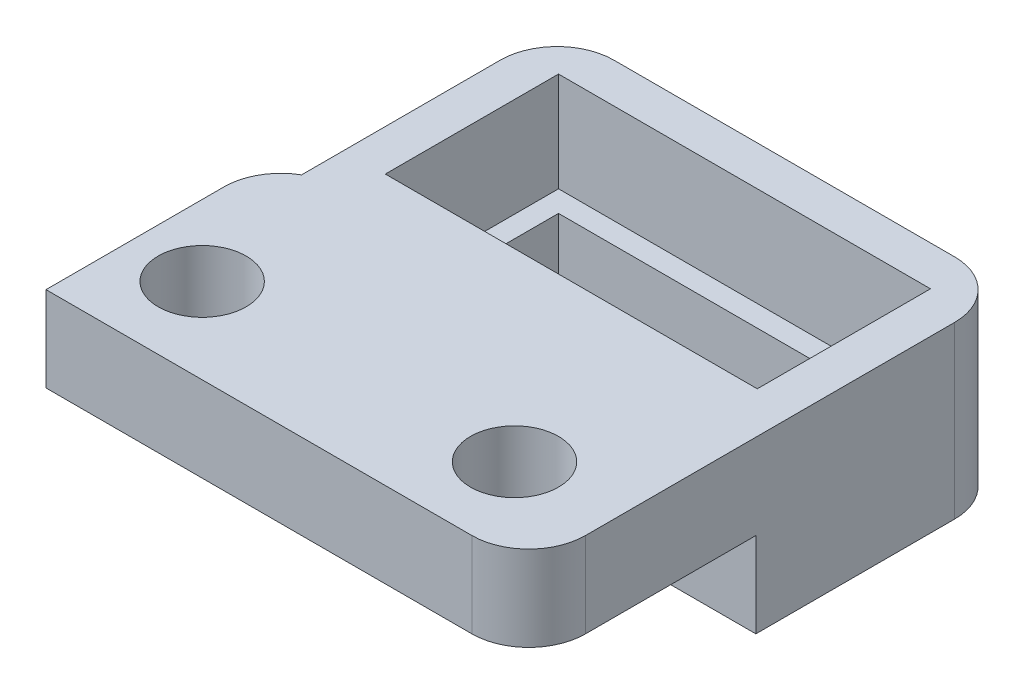
from build123d import *

# Parameters (mm, degrees)
CROQUIS1_W              = 18
CROQUIS1_H              = 18
CROQUIS1_R              = 1.55
SALIENTE_EXTRUIR1_DEPTH = 3
CROQUIS3_W              = 18
CROQUIS3_H              = 10
SALIENTE_EXTRUIR3_DEPTH = 3
CORTAR_EXTRUIR1_REACH   = 28.153
CROQUIS4_W              = 2
CROQUIS4_H              = 10
CROQUIS7_W              = 13.1
CROQUIS7_H              = 6.1
CORTAR_EXTRUIR2_DEPTH   = 6
CROQUIS9_W              = 16
CROQUIS9_H              = 10
CROQUIS9_W_2            = 13.1
CROQUIS9_H_2            = 6.1
SALIENTE_EXTRUIR4_DEPTH = 3
CROQUIS10_W             = 13.1
CROQUIS10_H             = 6.1
CROQUIS10_W_2           = 11.6
CROQUIS10_H_2           = 4.6
SALIENTE_EXTRUIR6_DEPTH = 2.5
CROQUIS11_W             = 16
CROQUIS11_H             = 1
CORTAR_EXTRUIR4_DEPTH   = 9
REDONDEO1_R             = 2
CROQUIS12_W             = 8
CROQUIS12_H             = 3
CORTAR_EXTRUIR5_DEPTH   = 1
CROQUIS14_W             = 16
CROQUIS14_H             = 3
CORTAR_EXTRUIR6_DEPTH   = 9
REDONDEO2_R             = 2


with BuildPart() as part:
    # Croquis1 → Saliente-Extruir1 (new body)
    with BuildSketch(Plane(origin=(0, 0, 0), x_dir=(1, 0, 0), z_dir=(0, 1, 0))):
        with Locations((9, 9)):
            Rectangle(CROQUIS1_W, CROQUIS1_H)
        with Locations(Location((3.5, 3, 0), (0, 0, 270))):
            Circle(CROQUIS1_R, mode=Mode.SUBTRACT)
        with Locations(Location((14.5, 3, 0), (0, 0, 270))):
            Circle(CROQUIS1_R, mode=Mode.SUBTRACT)
    extrude(amount=SALIENTE_EXTRUIR1_DEPTH)

    # Croquis3 → Saliente-Extruir3 (add)
    with BuildSketch(Plane(origin=(0, 3, 0), x_dir=(1, 0, 0), z_dir=(0, 1, 0))):
        with Locations((9, 13)):
            Rectangle(CROQUIS3_W, CROQUIS3_H)
    extrude(amount=SALIENTE_EXTRUIR3_DEPTH)

    # Cortar-Extruir1: up to this face of the body (flat: up to its plane)
    cortar_extruir1_end = Plane(part.part.faces().sort_by_distance((9, 6, -13))[0])
    # Croquis4 → Cortar-Extruir1 (cut, up to the picked face)
    with BuildSketch(Plane.XZ, mode=Mode.PRIVATE) as cortar_extruir1_sk1:
        with Locations((1, -13)):
            Rectangle(CROQUIS4_W, CROQUIS4_H)
    cortar_extruir1_tool1 = split(extrude(cortar_extruir1_sk1.sketch, amount=-CORTAR_EXTRUIR1_REACH, mode=Mode.PRIVATE), bisect_by=cortar_extruir1_end, keep=Keep.BOTH, mode=Mode.PRIVATE)
    add(cortar_extruir1_tool1.solids().sort_by(Axis((1, 0, -13), (0, 1, 0)))[0], mode=Mode.SUBTRACT)

    # Croquis7 → Cortar-Extruir2 (cut)
    with BuildSketch(Plane(origin=(0, 6, 0), x_dir=(1, 0, 0), z_dir=(0, 1, 0))):
        with Locations((10, 12.55)):
            Rectangle(CROQUIS7_W, CROQUIS7_H)
    extrude(amount=-CORTAR_EXTRUIR2_DEPTH, mode=Mode.SUBTRACT)

    # Croquis9 → Saliente-Extruir4 (add)
    with BuildSketch(Plane.XZ):
        with Locations((10, -13)):
            Rectangle(CROQUIS9_W, CROQUIS9_H)
        with Locations((10, -12.55)):
            Rectangle(CROQUIS9_W_2, CROQUIS9_H_2, mode=Mode.SUBTRACT)
    extrude(amount=SALIENTE_EXTRUIR4_DEPTH)

    # Croquis10 → Saliente-Extruir6 (add)
    with BuildSketch(Plane.XZ.offset(3)):
        with Locations((10, -12.55)):
            Rectangle(CROQUIS10_W, CROQUIS10_H)
        with Locations((10, -12.55)):
            Rectangle(CROQUIS10_W_2, CROQUIS10_H_2, mode=Mode.SUBTRACT)
    extrude(amount=-SALIENTE_EXTRUIR6_DEPTH)

    # Croquis11 → Cortar-Extruir4 (cut)
    with BuildSketch(Plane(origin=(0, 6, 0), x_dir=(1, 0, 0), z_dir=(0, 1, 0))):
        with Locations((10, 17.5)):
            Rectangle(CROQUIS11_W, CROQUIS11_H)
    extrude(amount=-CORTAR_EXTRUIR4_DEPTH, mode=Mode.SUBTRACT)

    # Redondeo1
    redondeo1_edges = [part.edges().sort_by_distance(p)[0] for p in [
        (18, 1.5, -17),
        (2, 1.5, -17),
        (18, 1.5, 0),
    ]]
    fillet(redondeo1_edges, radius=REDONDEO1_R)

    # Croquis12 → Cortar-Extruir5 (cut)
    with BuildSketch(Plane.ZY):
        with Locations((-4, 1.5)):
            Rectangle(CROQUIS12_W, CROQUIS12_H)
    extrude(amount=-CORTAR_EXTRUIR5_DEPTH, mode=Mode.SUBTRACT)

    # Croquis14 → Cortar-Extruir6 (cut)
    with BuildSketch(Plane.XY.offset(-8)):
        with Locations((10, 4.5)):
            Rectangle(CROQUIS14_W, CROQUIS14_H)
    extrude(amount=-CORTAR_EXTRUIR6_DEPTH, mode=Mode.SUBTRACT)

    # Redondeo2
    # the kernel refuses this fillet: 2 mm, written as the material it takes off along each edge
    with BuildSketch(Plane(origin=(1, 7.330127019, -8), x_dir=(0, 0, 1), z_dir=(0, -1, 0))) as redondeo2_piece_1:
        with BuildLine():
            CenterArc((1.732050808, -2), REDONDEO2_R, 90, 60)
            Line((0, -1), (-0.034641016, -0.98))
            ThreePointArc((-0.034641016, -0.98), (-0.04, -0.5), (-0.04, 0))
            Line((-0.04, 0), (0, 0.04))
            Line((0, 0.04), (1.732050808, 0.04))
            Line((1.732050808, 0.04), (1.732050808, 0))
        make_face()
    extrude(amount=11.660254038, mode=Mode.SUBTRACT)


solid = part.part
